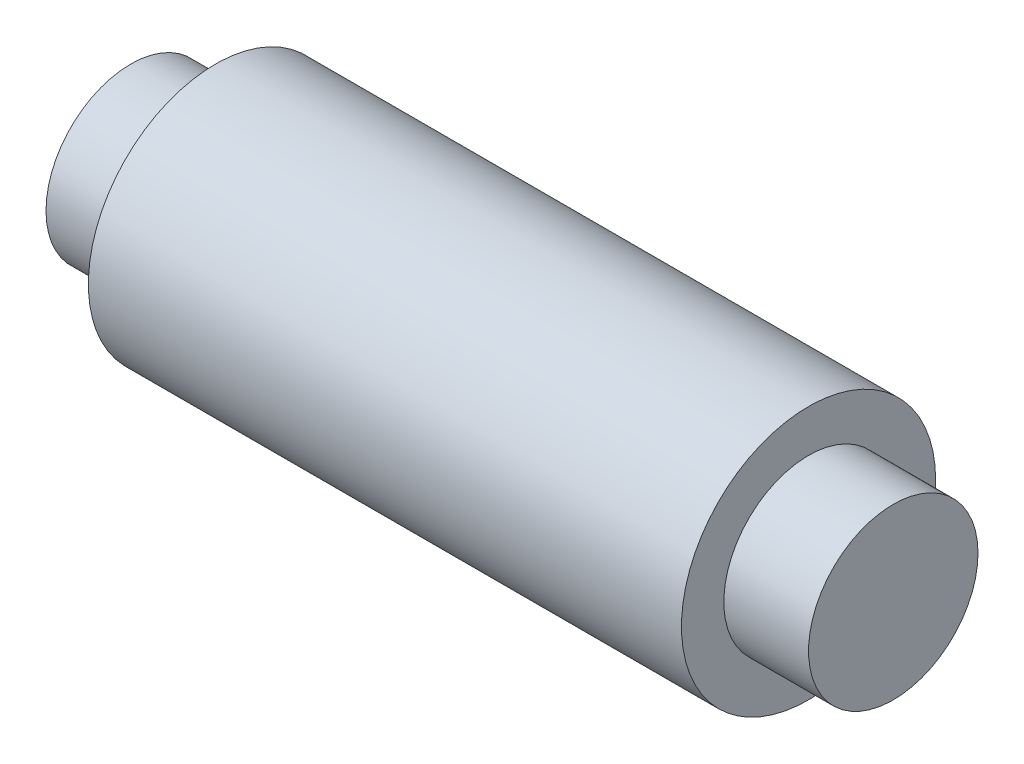
from build123d import *

# Parameters (mm, degrees)
SKETCH_ROLLING_WHEEL_R     = 15
ROLLING_WHEEL_DEPTH        = 35
SKETCH_WHEEL_SHAFT_RIGHT_R = 10
WHEEL_SHAFT_RIGHT_DEPTH    = 10
WHEEL_START                = 10
SKETCH_WHEEL_SHAFT_LEFT_R  = 10
WHEEL_SHAFT_LEFT_DEPTH     = 10


with BuildPart() as part:
    # Sketch_Rolling Wheel → Rolling Wheel (new, symmetric)
    with BuildSketch(Plane(origin=(0, 0, 0), x_dir=(0, 0, -1), z_dir=(1, 0, 0))):
        Circle(SKETCH_ROLLING_WHEEL_R)
    extrude(amount=ROLLING_WHEEL_DEPTH, both=True)

    # Sketch_Wheel Shaft_ Right → Wheel Shaft_ Right (add)
    with BuildSketch(Plane(origin=(35, 0, 0), x_dir=(0, 0, -1), z_dir=(1, 0, 0))):
        Circle(SKETCH_WHEEL_SHAFT_RIGHT_R)
    extrude(amount=WHEEL_SHAFT_RIGHT_DEPTH)

    # Sketch_Wheel Shaft_ Left → Wheel Shaft_ Left (add)
    with BuildSketch(Plane.ZY.offset(35).offset(WHEEL_START)):
        Circle(SKETCH_WHEEL_SHAFT_LEFT_R)
    extrude(amount=-WHEEL_SHAFT_LEFT_DEPTH)


solid = part.part
